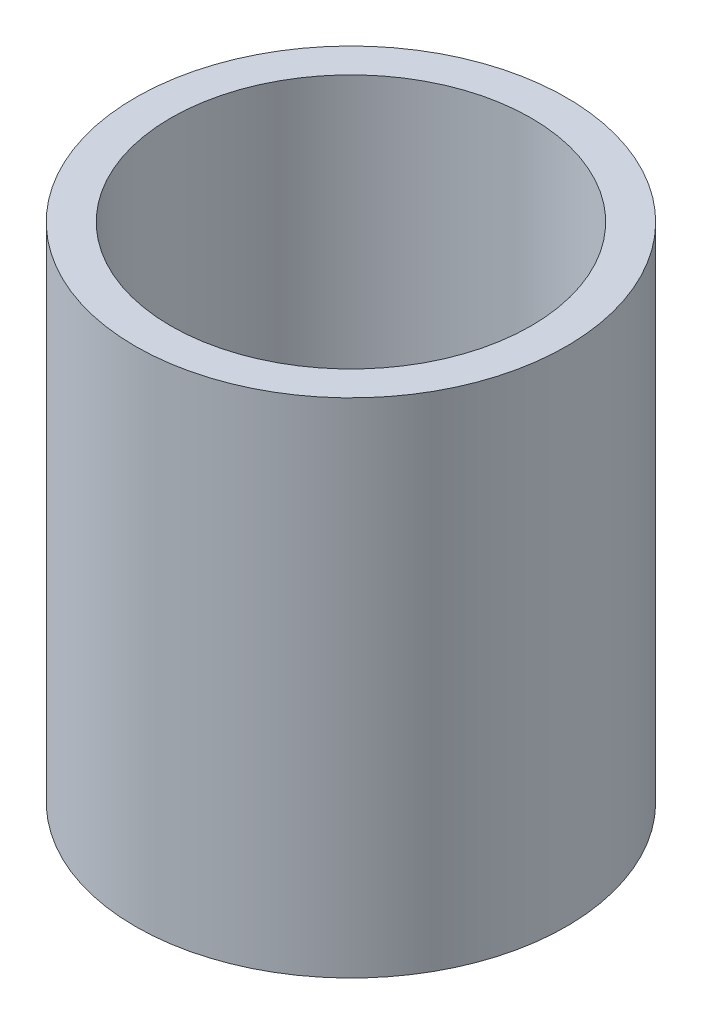
from build123d import *

# Parameters (mm, degrees)
SKETCH1_R           = 20
BOSS_EXTRUDE1_DEPTH = 46.635447052
SKETCH2_R           = 16.719593594
CUT_EXTRUDE1_DEPTH  = 55.542322299


with BuildPart() as part:
    # Sketch1 → Boss-Extrude1 (new body)
    with BuildSketch(Plane(origin=(0, 0, 0), x_dir=(1, 0, 0), z_dir=(0, 1, 0))):
        Circle(SKETCH1_R)
    extrude(amount=BOSS_EXTRUDE1_DEPTH)

    # Sketch2 → Cut-Extrude1 (cut, through all)
    with BuildSketch(Plane(origin=(0, 0, 0), x_dir=(1, 0, 0), z_dir=(0, 1, 0))):
        Circle(SKETCH2_R)
    extrude(amount=CUT_EXTRUDE1_DEPTH, mode=Mode.SUBTRACT)


solid = part.part
